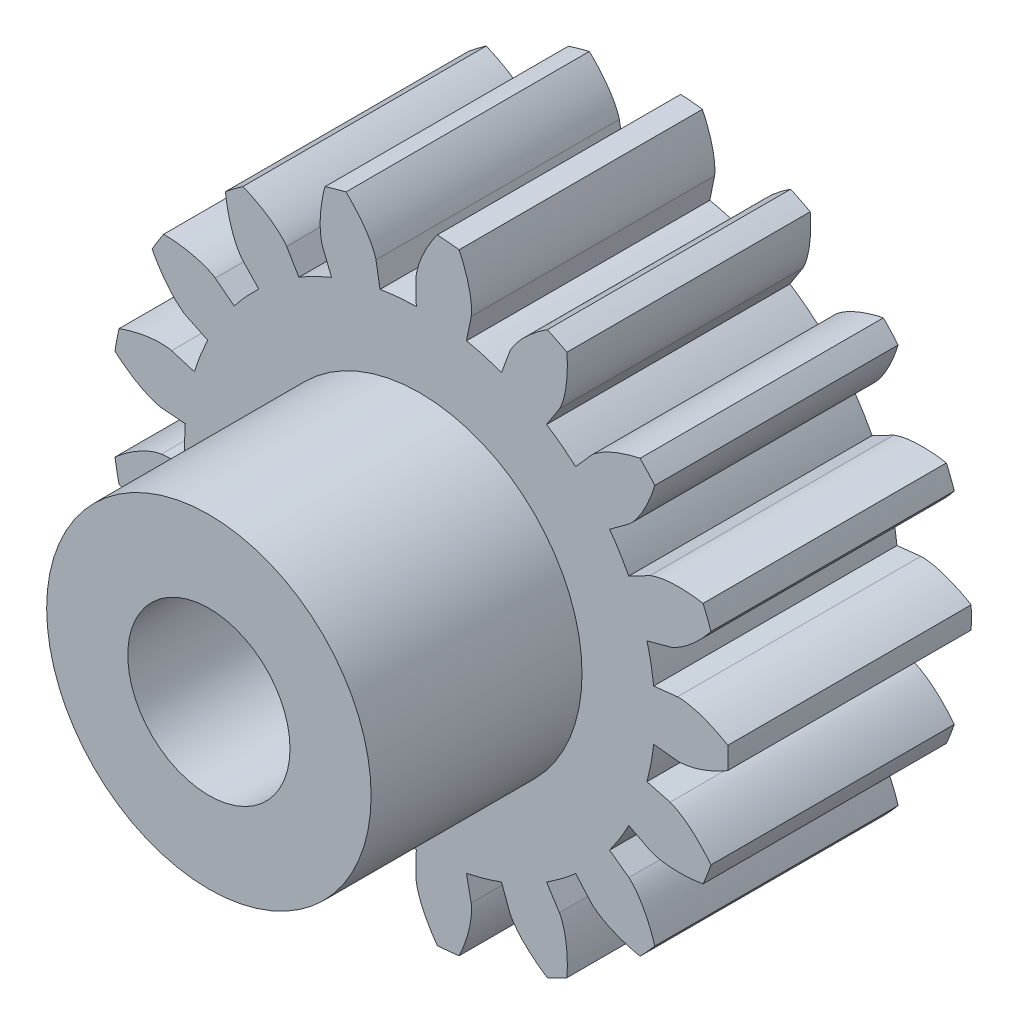
from build123d import *

# Parameters (mm, degrees)
SZKIC1_R                    = 9.5
DODANIE_WYCI_GNI_CIE1_DEPTH = 7.5
SZKIC2_R                    = 5
DODANIE_WYCI_GNI_CIE2_DEPTH = 6.5
SZKIC3_R                    = 2.5
WYTNIJ_WYCI_GNI_CIE1_DEPTH  = 20.403607912
WYTNIJ_WYCI_GNI_CIE3_DEPTH  = 10


with BuildPart() as part:
    # Szkic1 → Dodanie-wyciągnięcie1 (new body)
    with BuildSketch(Plane.XY):
        Circle(SZKIC1_R)
    extrude(amount=DODANIE_WYCI_GNI_CIE1_DEPTH)

    # Szkic2 → Dodanie-wyciągnięcie2 (add)
    with BuildSketch(Plane.XY.offset(7.5)):
        Circle(SZKIC2_R)
    extrude(amount=DODANIE_WYCI_GNI_CIE2_DEPTH)

    # Szkic3 → Wytnij-wyciągnięcie1 (cut, through all)
    with BuildSketch(Plane.XY.offset(14)):
        Circle(SZKIC3_R)
    extrude(amount=-WYTNIJ_WYCI_GNI_CIE1_DEPTH, mode=Mode.SUBTRACT)

    # Szkic5 → Wytnij-wyciągnięcie3 (cut)
    with BuildSketch(Plane(origin=(0, 0, 0), x_dir=(-1, 0, 0), z_dir=(0, 0, -1))):
        with BuildLine():
            add(Edge.make_bspline(
                [(7.963415002, 0.618366401), (7.966722573, 0.618676105), (7.975983606, 0.619707212), (7.993424766, 0.622297686), (8.021760868, 0.627431857), (8.057662939, 0.635303285), (8.103794176, 0.646996952), (8.157749457, 0.662718274), (8.216590608, 0.682022962), (8.280068362, 0.705199458), (8.342882573, 0.730232638), (8.405029368, 0.75697113), (8.466451614, 0.785192994), (8.540242586, 0.821237905), (8.627851604, 0.867035666), (8.728883622, 0.92427545), (8.841778762, 0.993539678), (8.954897675, 1.068706007), (9.064568692, 1.146407595), (9.173368323, 1.229133774), (9.267644132, 1.304516793), (9.337006218, 1.36343296), (9.378413038, 1.399396049), (9.394282015, 1.413317167)],
                knots=[0, 0, 0, 0, 0, 0.005376749, 0.015083688, 0.02853182, 0.046610139, 0.064854849, 0.092110525, 0.119476176, 0.146842496, 0.174208854, 0.201574956, 0.228941013, 0.256307345, 0.307035032, 0.361767352, 0.416499661, 0.471231937, 0.525964282, 0.580696615, 0.635428982, 0.670002826, 0.670002826, 0.670002826, 0.670002826, 0.670002826], degree=4))
            Line((7.963415002, 0.618366401), (7.228240821, 0.561279459))
            add(Edge.make_bspline(
                [(7.228240821, 0.561279459), (7.27156332, -0.003365835), (7.228240821, -0.561279459)],
                knots=[0, 0, 0, 0.49973366, 0.49973366, 0.49973366], degree=2))
            Line((7.228240821, -0.561279459), (7.963415002, -0.618366401))
            add(Edge.make_bspline(
                [(7.963415002, -0.618366401), (7.966722573, -0.618676105), (7.975983606, -0.619707212), (7.993424766, -0.622297686), (8.021760868, -0.627431857), (8.057662939, -0.635303285), (8.103794176, -0.646996952), (8.157749457, -0.662718274), (8.216590608, -0.682022962), (8.280068362, -0.705199458), (8.342882573, -0.730232638), (8.405029368, -0.75697113), (8.466451614, -0.785192994), (8.540242586, -0.821237905), (8.627851604, -0.867035666), (8.728883622, -0.92427545), (8.841778762, -0.993539678), (8.954897675, -1.068706007), (9.064568692, -1.146407595), (9.173368323, -1.229133774), (9.267644132, -1.304516793), (9.337006218, -1.36343296), (9.378413038, -1.399396049), (9.394282015, -1.413317167)],
                knots=[0, 0, 0, 0, 0, 0.005376749, 0.015083688, 0.02853182, 0.046610139, 0.064854849, 0.092110525, 0.119476176, 0.146842496, 0.174208854, 0.201574956, 0.228941013, 0.256307345, 0.307035032, 0.361767352, 0.416499661, 0.471231937, 0.525964282, 0.580696615, 0.635428982, 0.670002826, 0.670002826, 0.670002826, 0.670002826, 0.670002826], degree=4))
            ThreePointArc((9.394282015, -1.413317167), (9.5, 0), (9.394282015, 1.413317167))
        make_face()
        with BuildLine():
            add(Edge.make_bspline(
                [(7.64904305, 2.300107807), (7.652239145, 2.301013849), (7.66124728, 2.303397841), (7.678446465, 2.307282771), (7.70672377, 2.31273148), (7.743044942, 2.318360915), (7.790285279, 2.324121421), (7.846276277, 2.32895262), (7.908117674, 2.33220741), (7.975681232, 2.333526781), (8.043296767, 2.332875145), (8.110905985, 2.330392256), (8.178375437, 2.326264426), (8.260204393, 2.319309921), (8.358441429, 2.308252809), (8.473328375, 2.291375274), (8.603621083, 2.267570734), (8.736254537, 2.238343484), (8.866588767, 2.205506652), (8.997925544, 2.167669747), (9.113066604, 2.131433526), (9.199027798, 2.101552312), (9.250629874, 2.082975598), (9.270456143, 2.075727078)],
                knots=[0, 0, 0, 0, 0, 0.005376749, 0.015083688, 0.02853182, 0.046610139, 0.064854849, 0.092110525, 0.119476176, 0.146842496, 0.174208854, 0.201574956, 0.228941013, 0.256307345, 0.307035032, 0.361767352, 0.416499661, 0.471231937, 0.525964282, 0.580696615, 0.635428982, 0.670002826, 0.670002826, 0.670002826, 0.670002826, 0.670002826], degree=4))
            ThreePointArc((9.270456143, 2.075727078), (8.858486179, 3.431795829), (8.249358046, 4.711485098))
            add(Edge.make_bspline(
                [(7.202283632, 3.453326801), (7.205255971, 3.454810423), (7.213519148, 3.459117373), (7.228846759, 3.467833391), (7.253414711, 3.482857044), (7.284048907, 3.503166256), (7.322840765, 3.530734801), (7.36747337, 3.564885393), (7.415367451, 3.604142354), (7.466186378, 3.648684602), (7.515715857, 3.694718458), (7.56400696, 3.74210137), (7.611086586, 3.790605749), (7.666873694, 3.850873001), (7.732022612, 3.925226169), (7.805554768, 4.015097653), (7.885805226, 4.12046705), (7.96413226, 4.231420829), (8.038328387, 4.343493144), (8.109896879, 4.459935968), (8.170574965, 4.56428489), (8.21397021, 4.644279055), (8.239589553, 4.692771506), (8.249358046, 4.711485098)],
                knots=[0, 0, 0, 0, 0, 0.005376749, 0.015083688, 0.02853182, 0.046610139, 0.064854849, 0.092110525, 0.119476176, 0.146842496, 0.174208854, 0.201574956, 0.228941013, 0.256307345, 0.307035032, 0.361767352, 0.416499661, 0.471231937, 0.525964282, 0.580696615, 0.635428982, 0.670002826, 0.670002826, 0.670002826, 0.670002826, 0.670002826], degree=4))
            Line((7.202283632, 3.453326801), (6.537376306, 3.134519266))
            add(Edge.make_bspline(
                [(6.537376306, 3.134519266), (6.78174674, 2.623653102), (6.94289136, 2.087764249)],
                knots=[0, 0, 0, 0.49973366, 0.49973366, 0.49973366], degree=2))
            Line((6.94289136, 2.087764249), (7.64904305, 2.300107807))
        make_face()
        with BuildLine():
            ThreePointArc((8.249358046, -4.711485098), (8.858486179, -3.431795829), (9.270456143, -2.075727078))
            add(Edge.make_bspline(
                [(7.64904305, -2.300107807), (7.652239145, -2.301013849), (7.66124728, -2.303397841), (7.678446465, -2.307282771), (7.70672377, -2.31273148), (7.743044942, -2.318360915), (7.790285279, -2.324121421), (7.846276277, -2.32895262), (7.908117674, -2.33220741), (7.975681232, -2.333526781), (8.043296767, -2.332875145), (8.110905985, -2.330392256), (8.178375437, -2.326264426), (8.260204393, -2.319309921), (8.358441429, -2.308252809), (8.473328375, -2.291375274), (8.603621083, -2.267570734), (8.736254537, -2.238343484), (8.866588767, -2.205506652), (8.997925544, -2.167669747), (9.113066604, -2.131433526), (9.199027798, -2.101552312), (9.250629874, -2.082975598), (9.270456143, -2.075727078)],
                knots=[0, 0, 0, 0, 0, 0.005376749, 0.015083688, 0.02853182, 0.046610139, 0.064854849, 0.092110525, 0.119476176, 0.146842496, 0.174208854, 0.201574956, 0.228941013, 0.256307345, 0.307035032, 0.361767352, 0.416499661, 0.471231937, 0.525964282, 0.580696615, 0.635428982, 0.670002826, 0.670002826, 0.670002826, 0.670002826, 0.670002826], degree=4))
            Line((7.64904305, -2.300107807), (6.94289136, -2.087764249))
            add(Edge.make_bspline(
                [(6.94289136, -2.087764249), (6.779314981, -2.629930197), (6.537376306, -3.134519266)],
                knots=[0, 0, 0, 0.49973366, 0.49973366, 0.49973366], degree=2))
            Line((6.537376306, -3.134519266), (7.202283632, -3.453326801))
            add(Edge.make_bspline(
                [(7.202283632, -3.453326801), (7.205255971, -3.454810423), (7.213519148, -3.459117373), (7.228846759, -3.467833391), (7.253414711, -3.482857044), (7.284048907, -3.503166256), (7.322840765, -3.530734801), (7.36747337, -3.564885393), (7.415367451, -3.604142354), (7.466186378, -3.648684602), (7.515715857, -3.694718458), (7.56400696, -3.74210137), (7.611086586, -3.790605749), (7.666873694, -3.850873001), (7.732022612, -3.925226169), (7.805554768, -4.015097653), (7.885805226, -4.12046705), (7.96413226, -4.231420829), (8.038328387, -4.343493144), (8.109896879, -4.459935968), (8.170574965, -4.56428489), (8.21397021, -4.644279055), (8.239589553, -4.692771506), (8.249358046, -4.711485098)],
                knots=[0, 0, 0, 0, 0, 0.005376749, 0.015083688, 0.02853182, 0.046610139, 0.064854849, 0.092110525, 0.119476176, 0.146842496, 0.174208854, 0.201574956, 0.228941013, 0.256307345, 0.307035032, 0.361767352, 0.416499661, 0.471231937, 0.525964282, 0.580696615, 0.635428982, 0.670002826, 0.670002826, 0.670002826, 0.670002826, 0.670002826], degree=4))
        make_face()
        with BuildLine():
            add(Edge.make_bspline(
                [(6.301625449, 4.907939711), (6.304278419, 4.909939133), (6.311817057, 4.915416253), (6.326451421, 4.925251904), (6.350850922, 4.940547614), (6.382685819, 4.958917627), (6.424655188, 4.981354317), (6.475120007, 5.006085558), (6.531609627, 5.031460248), (6.594134157, 5.057097297), (6.657419164, 5.080915213), (6.721359805, 5.103023255), (6.785764339, 5.123546945), (6.864579825, 5.146622091), (6.960177423, 5.171798951), (7.073403179, 5.197563071), (7.203496702, 5.222433153), (7.337731815, 5.243092284), (7.471126897, 5.259555004), (7.60726306, 5.271717457), (7.727718935, 5.279521936), (7.818669701, 5.282711298), (7.873497886, 5.284029849), (7.894603799, 5.284432879)],
                knots=[0, 0, 0, 0, 0, 0.005376749, 0.015083688, 0.02853182, 0.046610139, 0.064854849, 0.092110525, 0.119476176, 0.146842496, 0.174208854, 0.201574956, 0.228941013, 0.256307345, 0.307035032, 0.361767352, 0.416499661, 0.471231937, 0.525964282, 0.580696615, 0.635428982, 0.670002826, 0.670002826, 0.670002826, 0.670002826, 0.670002826], degree=4))
            ThreePointArc((7.894603799, 5.284432879), (7.020584714, 6.400108615), (5.990312562, 7.373340858))
            add(Edge.make_bspline(
                [(5.468443947, 5.82189628), (5.470679625, 5.82435345), (5.476828959, 5.831354565), (5.487972941, 5.845018982), (5.505454705, 5.867903088), (5.526683708, 5.897907213), (5.552897132, 5.93762735), (5.58217918, 5.985594985), (5.61265783, 6.039502349), (5.643954552, 6.099394672), (5.673510069, 6.160212076), (5.7014235, 6.221840085), (5.727802141, 6.284076193), (5.758051027, 6.360426361), (5.791941121, 6.453293128), (5.82804249, 6.56365867), (5.864809997, 6.690902515), (5.897766653, 6.822658822), (5.926467292, 6.953965875), (5.951138923, 7.088399096), (5.970024375, 7.207621021), (5.98159201, 7.297889529), (5.987963842, 7.352362167), (5.990312562, 7.373340858)],
                knots=[0, 0, 0, 0, 0, 0.005376749, 0.015083688, 0.02853182, 0.046610139, 0.064854849, 0.092110525, 0.119476176, 0.146842496, 0.174208854, 0.201574956, 0.228941013, 0.256307345, 0.307035032, 0.361767352, 0.416499661, 0.471231937, 0.525964282, 0.580696615, 0.635428982, 0.670002826, 0.670002826, 0.670002826, 0.670002826, 0.670002826], degree=4))
            Line((5.468443947, 5.82189628), (4.963602896, 5.284424878))
            add(Edge.make_bspline(
                [(4.963602896, 5.284424878), (5.376017684, 4.896333149), (5.719865949, 4.454843827)],
                knots=[0, 0, 0, 0.49973366, 0.49973366, 0.49973366], degree=2))
            Line((5.719865949, 4.454843827), (6.301625449, 4.907939711))
        make_face()
        with BuildLine():
            ThreePointArc((5.990312562, -7.373340858), (7.020584714, -6.400108615), (7.894603799, -5.284432879))
            add(Edge.make_bspline(
                [(6.301625449, -4.907939711), (6.304278419, -4.909939133), (6.311817057, -4.915416253), (6.326451421, -4.925251904), (6.350850922, -4.940547614), (6.382685819, -4.958917627), (6.424655188, -4.981354317), (6.475120007, -5.006085558), (6.531609627, -5.031460248), (6.594134157, -5.057097297), (6.657419164, -5.080915213), (6.721359805, -5.103023255), (6.785764339, -5.123546945), (6.864579825, -5.146622091), (6.960177423, -5.171798951), (7.073403179, -5.197563071), (7.203496702, -5.222433153), (7.337731815, -5.243092284), (7.471126897, -5.259555004), (7.60726306, -5.271717457), (7.727718935, -5.279521936), (7.818669701, -5.282711298), (7.873497886, -5.284029849), (7.894603799, -5.284432879)],
                knots=[0, 0, 0, 0, 0, 0.005376749, 0.015083688, 0.02853182, 0.046610139, 0.064854849, 0.092110525, 0.119476176, 0.146842496, 0.174208854, 0.201574956, 0.228941013, 0.256307345, 0.307035032, 0.361767352, 0.416499661, 0.471231937, 0.525964282, 0.580696615, 0.635428982, 0.670002826, 0.670002826, 0.670002826, 0.670002826, 0.670002826], degree=4))
            Line((6.301625449, -4.907939711), (5.719865949, -4.454843827))
            add(Edge.make_bspline(
                [(5.719865949, -4.454843827), (5.371482587, -4.901307914), (4.963602896, -5.284424878)],
                knots=[0, 0, 0, 0.49973366, 0.49973366, 0.49973366], degree=2))
            Line((4.963602896, -5.284424878), (5.468443947, -5.82189628))
            add(Edge.make_bspline(
                [(5.468443947, -5.82189628), (5.470679625, -5.82435345), (5.476828959, -5.831354565), (5.487972941, -5.845018982), (5.505454705, -5.867903088), (5.526683708, -5.897907213), (5.552897132, -5.93762735), (5.58217918, -5.985594985), (5.61265783, -6.039502349), (5.643954552, -6.099394672), (5.673510069, -6.160212076), (5.7014235, -6.221840085), (5.727802141, -6.284076193), (5.758051027, -6.360426361), (5.791941121, -6.453293128), (5.82804249, -6.56365867), (5.864809997, -6.690902515), (5.897766653, -6.822658822), (5.926467292, -6.953965875), (5.951138923, -7.088399096), (5.970024375, -7.207621021), (5.98159201, -7.297889529), (5.987963842, -7.352362167), (5.990312562, -7.373340858)],
                knots=[0, 0, 0, 0, 0, 0.005376749, 0.015083688, 0.02853182, 0.046610139, 0.064854849, 0.092110525, 0.119476176, 0.146842496, 0.174208854, 0.201574956, 0.228941013, 0.256307345, 0.307035032, 0.361767352, 0.416499661, 0.471231937, 0.525964282, 0.580696615, 0.635428982, 0.670002826, 0.670002826, 0.670002826, 0.670002826, 0.670002826], degree=4))
        make_face()
        with BuildLine():
            add(Edge.make_bspline(
                [(4.103138413, 6.852927161), (4.104889959, 6.85574993), (4.109940966, 6.863580462), (4.120034057, 6.878038476), (4.137260466, 6.901115417), (4.160309609, 6.929745035), (4.191339813, 6.96582771), (4.229462901, 7.007118901), (4.272971507, 7.051186499), (4.322012725, 7.097678801), (4.372420212, 7.142749528), (4.424056739, 7.186462686), (4.476698166, 7.228866059), (4.541855714, 7.278854429), (4.621902888, 7.336864987), (4.718175688, 7.401791174), (4.830500175, 7.471977036), (4.948207752, 7.539732418), (5.066647941, 7.603271309), (5.189197548, 7.663790513), (5.298700003, 7.714581654), (5.382356935, 7.750410852), (5.433006381, 7.771446589), (5.452541466, 7.779446738)],
                knots=[0, 0, 0, 0, 0, 0.005376749, 0.015083688, 0.02853182, 0.046610139, 0.064854849, 0.092110525, 0.119476176, 0.146842496, 0.174208854, 0.201574956, 0.228941013, 0.256307345, 0.307035032, 0.361767352, 0.416499661, 0.471231937, 0.525964282, 0.580696615, 0.635428982, 0.670002826, 0.670002826, 0.670002826, 0.670002826, 0.670002826], degree=4))
            ThreePointArc((5.452541466, 7.779446738), (4.23451438, 8.504051268), (2.922242172, 9.039386079))
            add(Edge.make_bspline(
                [(2.996060606, 7.404186407), (2.997257682, 7.407285269), (3.00046267, 7.41603501), (3.005917968, 7.43280237), (3.013952534, 7.460456306), (3.02290925, 7.496103119), (3.033003971, 7.542610425), (3.042980759, 7.597916808), (3.051927668, 7.659194086), (3.05947539, 7.726347695), (3.065065308, 7.793734919), (3.068831202, 7.861284819), (3.070946277, 7.928847327), (3.071571662, 8.010968895), (3.069625888, 8.109807091), (3.063420779, 8.225761213), (3.05173968, 8.35769452), (3.034874979, 8.492458934), (3.014203949, 8.625266982), (2.988646679, 8.759534648), (2.963188911, 8.877527994), (2.941366664, 8.965879583), (2.927630434, 9.018975577), (2.922242172, 9.039386079)],
                knots=[0, 0, 0, 0, 0, 0.005376749, 0.015083688, 0.02853182, 0.046610139, 0.064854849, 0.092110525, 0.119476176, 0.146842496, 0.174208854, 0.201574956, 0.228941013, 0.256307345, 0.307035032, 0.361767352, 0.416499661, 0.471231937, 0.525964282, 0.580696615, 0.635428982, 0.670002826, 0.670002826, 0.670002826, 0.670002826, 0.670002826], degree=4))
            Line((2.996060606, 7.404186407), (2.719467411, 6.720639627))
            add(Edge.make_bspline(
                [(2.719467411, 6.720639627), (3.24422765, 6.507736273), (3.724340947, 6.220272061)],
                knots=[0, 0, 0, 0.49973366, 0.49973366, 0.49973366], degree=2))
            Line((3.724340947, 6.220272061), (4.103138413, 6.852927161))
        make_face()
        with BuildLine():
            ThreePointArc((2.922242172, -9.039386079), (4.23451438, -8.504051268), (5.452541466, -7.779446738))
            add(Edge.make_bspline(
                [(4.103138413, -6.852927161), (4.104889959, -6.85574993), (4.109940966, -6.863580462), (4.120034057, -6.878038476), (4.137260466, -6.901115417), (4.160309609, -6.929745035), (4.191339813, -6.96582771), (4.229462901, -7.007118901), (4.272971507, -7.051186499), (4.322012725, -7.097678801), (4.372420212, -7.142749528), (4.424056739, -7.186462686), (4.476698166, -7.228866059), (4.541855714, -7.278854429), (4.621902888, -7.336864987), (4.718175688, -7.401791174), (4.830500175, -7.471977036), (4.948207752, -7.539732418), (5.066647941, -7.603271309), (5.189197548, -7.663790513), (5.298700003, -7.714581654), (5.382356935, -7.750410852), (5.433006381, -7.771446589), (5.452541466, -7.779446738)],
                knots=[0, 0, 0, 0, 0, 0.005376749, 0.015083688, 0.02853182, 0.046610139, 0.064854849, 0.092110525, 0.119476176, 0.146842496, 0.174208854, 0.201574956, 0.228941013, 0.256307345, 0.307035032, 0.361767352, 0.416499661, 0.471231937, 0.525964282, 0.580696615, 0.635428982, 0.670002826, 0.670002826, 0.670002826, 0.670002826, 0.670002826], degree=4))
            Line((4.103138413, -6.852927161), (3.724340947, -6.220272061))
            add(Edge.make_bspline(
                [(3.724340947, -6.220272061), (3.238201706, -6.510736837), (2.719467411, -6.720639627)],
                knots=[0, 0, 0, 0.49973366, 0.49973366, 0.49973366], degree=2))
            Line((2.719467411, -6.720639627), (2.996060606, -7.404186407))
            add(Edge.make_bspline(
                [(2.996060606, -7.404186407), (2.997257682, -7.407285269), (3.00046267, -7.41603501), (3.005917968, -7.43280237), (3.013952534, -7.460456306), (3.02290925, -7.496103119), (3.033003971, -7.542610425), (3.042980759, -7.597916808), (3.051927668, -7.659194086), (3.05947539, -7.726347695), (3.065065308, -7.793734919), (3.068831202, -7.861284819), (3.070946277, -7.928847327), (3.071571662, -8.010968895), (3.069625888, -8.109807091), (3.063420779, -8.225761213), (3.05173968, -8.35769452), (3.034874979, -8.492458934), (3.014203949, -8.625266982), (2.988646679, -8.759534648), (2.963188911, -8.877527994), (2.941366664, -8.965879583), (2.927630434, -9.018975577), (2.922242172, -9.039386079)],
                knots=[0, 0, 0, 0, 0, 0.005376749, 0.015083688, 0.02853182, 0.046610139, 0.064854849, 0.092110525, 0.119476176, 0.146842496, 0.174208854, 0.201574956, 0.228941013, 0.256307345, 0.307035032, 0.361767352, 0.416499661, 0.471231937, 0.525964282, 0.580696615, 0.635428982, 0.670002826, 0.670002826, 0.670002826, 0.670002826, 0.670002826], degree=4))
        make_face()
        with BuildLine():
            add(Edge.make_bspline(
                [(1.350499797, 7.872388825), (1.351113364, 7.875653709), (1.352994573, 7.884780098), (1.357183263, 7.901907839), (1.364910058, 7.929649343), (1.376060534, 7.964671977), (1.391960771, 8.009527472), (1.412593394, 8.061802009), (1.437244908, 8.118610941), (1.466179525, 8.179679453), (1.496901683, 8.239915939), (1.529260296, 8.29933051), (1.5630291, 8.357886754), (1.605728822, 8.428037142), (1.659414758, 8.511046752), (1.725732426, 8.606366364), (1.805117834, 8.712389016), (1.890400813, 8.81808991), (1.977890105, 8.920123692), (2.070302152, 9.020826194), (2.154062274, 9.107744371), (2.219127041, 9.171374473), (2.258757258, 9.209286404), (2.274083195, 9.223803208)],
                knots=[0, 0, 0, 0, 0, 0.005376749, 0.015083688, 0.02853182, 0.046610139, 0.064854849, 0.092110525, 0.119476176, 0.146842496, 0.174208854, 0.201574956, 0.228941013, 0.256307345, 0.307035032, 0.361767352, 0.416499661, 0.471231937, 0.525964282, 0.580696615, 0.635428982, 0.670002826, 0.670002826, 0.670002826, 0.670002826, 0.670002826], degree=4))
            ThreePointArc((2.274083195, 9.223803208), (0.876549415, 9.459474675), (-0.540493215, 9.484612121))
            add(Edge.make_bspline(
                [(0.119042679, 7.986500131), (0.11903948, 7.989822168), (0.118867272, 7.999138833), (0.117897116, 8.016744612), (0.115399372, 8.045433559), (0.110874147, 8.081908761), (0.103486817, 8.128922166), (0.092810925, 8.184097864), (0.079017763, 8.244469221), (0.061797123, 8.309814647), (0.042666494, 8.374670674), (0.021776246, 8.439019478), (-0.000657898, 8.502783693), (-0.029740476, 8.579585691), (-0.067259331, 8.671046669), (-0.114932882, 8.776929123), (-0.173484991, 8.895733569), (-0.237893378, 9.01530541), (-0.30514434, 9.131677988), (-0.37747886, 9.247646508), (-0.443841634, 9.34847562), (-0.496106549, 9.422977918), (-0.528095687, 9.467526359), (-0.540493215, 9.484612121)],
                knots=[0, 0, 0, 0, 0, 0.005376749, 0.015083688, 0.02853182, 0.046610139, 0.064854849, 0.092110525, 0.119476176, 0.146842496, 0.174208854, 0.201574956, 0.228941013, 0.256307345, 0.307035032, 0.361767352, 0.416499661, 0.471231937, 0.525964282, 0.580696615, 0.635428982, 0.670002826, 0.670002826, 0.670002826, 0.670002826, 0.670002826], degree=4))
            Line((0.119042679, 7.986500131), (0.108052782, 7.249194755))
            add(Edge.make_bspline(
                [(0.108052782, 7.249194755), (0.674286695, 7.240233553), (1.225823062, 7.145618085)],
                knots=[0, 0, 0, 0.49973366, 0.49973366, 0.49973366], degree=2))
            Line((1.225823062, 7.145618085), (1.350499797, 7.872388825))
        make_face()
        with BuildLine():
            ThreePointArc((-0.540493215, -9.484612121), (0.876549415, -9.459474675), (2.274083195, -9.223803208))
            add(Edge.make_bspline(
                [(1.350499797, -7.872388825), (1.351113364, -7.875653709), (1.352994573, -7.884780098), (1.357183263, -7.901907839), (1.364910058, -7.929649343), (1.376060534, -7.964671977), (1.391960771, -8.009527472), (1.412593394, -8.061802009), (1.437244908, -8.118610941), (1.466179525, -8.179679453), (1.496901683, -8.239915939), (1.529260296, -8.29933051), (1.5630291, -8.357886754), (1.605728822, -8.428037142), (1.659414758, -8.511046752), (1.725732426, -8.606366364), (1.805117834, -8.712389016), (1.890400813, -8.81808991), (1.977890105, -8.920123692), (2.070302152, -9.020826194), (2.154062274, -9.107744371), (2.219127041, -9.171374473), (2.258757258, -9.209286404), (2.274083195, -9.223803208)],
                knots=[0, 0, 0, 0, 0, 0.005376749, 0.015083688, 0.02853182, 0.046610139, 0.064854849, 0.092110525, 0.119476176, 0.146842496, 0.174208854, 0.201574956, 0.228941013, 0.256307345, 0.307035032, 0.361767352, 0.416499661, 0.471231937, 0.525964282, 0.580696615, 0.635428982, 0.670002826, 0.670002826, 0.670002826, 0.670002826, 0.670002826], degree=4))
            Line((1.350499797, -7.872388825), (1.225823062, -7.145618085))
            add(Edge.make_bspline(
                [(1.225823062, -7.145618085), (0.667583741, -7.240854673), (0.108052782, -7.249194755)],
                knots=[0, 0, 0, 0.49973366, 0.49973366, 0.49973366], degree=2))
            Line((0.108052782, -7.249194755), (0.119042679, -7.986500131))
            add(Edge.make_bspline(
                [(0.119042679, -7.986500131), (0.11903948, -7.989822168), (0.118867272, -7.999138833), (0.117897116, -8.016744612), (0.115399372, -8.045433559), (0.110874147, -8.081908761), (0.103486817, -8.128922166), (0.092810925, -8.184097864), (0.079017763, -8.244469221), (0.061797123, -8.309814647), (0.042666494, -8.374670674), (0.021776246, -8.439019478), (-0.000657898, -8.502783693), (-0.029740476, -8.579585691), (-0.067259331, -8.671046669), (-0.114932882, -8.776929123), (-0.173484991, -8.895733569), (-0.237893378, -9.01530541), (-0.30514434, -9.131677988), (-0.37747886, -9.247646508), (-0.443841634, -9.34847562), (-0.496106549, -9.422977918), (-0.528095687, -9.467526359), (-0.540493215, -9.484612121)],
                knots=[0, 0, 0, 0, 0, 0.005376749, 0.015083688, 0.02853182, 0.046610139, 0.064854849, 0.092110525, 0.119476176, 0.146842496, 0.174208854, 0.201574956, 0.228941013, 0.256307345, 0.307035032, 0.361767352, 0.416499661, 0.471231937, 0.525964282, 0.580696615, 0.635428982, 0.670002826, 0.670002826, 0.670002826, 0.670002826, 0.670002826], degree=4))
        make_face()
        with BuildLine():
            add(Edge.make_bspline(
                [(-1.584531299, 7.828640755), (-1.585138578, 7.831906815), (-1.586681234, 7.84109649), (-1.588962651, 7.858580762), (-1.591779016, 7.887240185), (-1.594033142, 7.923925835), (-1.595410286, 7.971496166), (-1.595054679, 8.027694083), (-1.59258958, 8.089571989), (-1.587669344, 8.15696907), (-1.580781714, 8.224236044), (-1.572071224, 8.29132776), (-1.561735708, 8.358128531), (-1.547260646, 8.438966738), (-1.527186531, 8.535764491), (-1.499780563, 8.648604088), (-1.464055674, 8.776144584), (-1.422715231, 8.905515497), (-1.37799275, 9.032263943), (-1.328199022, 9.159549311), (-1.281493501, 9.270855744), (-1.243808256, 9.353693151), (-1.220549549, 9.403361059), (-1.211502613, 9.422433944)],
                knots=[0, 0, 0, 0, 0, 0.005376749, 0.015083688, 0.02853182, 0.046610139, 0.064854849, 0.092110525, 0.119476176, 0.146842496, 0.174208854, 0.201574956, 0.228941013, 0.256307345, 0.307035032, 0.361767352, 0.416499661, 0.471231937, 0.525964282, 0.580696615, 0.635428982, 0.670002826, 0.670002826, 0.670002826, 0.670002826, 0.670002826], degree=4))
            ThreePointArc((-1.211502613, 9.422433944), (-2.599798406, 9.13734361), (-3.930231999, 8.64888874))
            add(Edge.make_bspline(
                [(-2.774052623, 7.490192758), (-2.775255663, 7.49328931), (-2.77878181, 7.501914633), (-2.786046394, 7.517981071), (-2.798739114, 7.543830429), (-2.816135124, 7.576207842), (-2.840006805, 7.617377925), (-2.869893539, 7.664971154), (-2.904563928, 7.716283103), (-2.944227188, 7.770995086), (-2.985494668, 7.824560749), (-3.028219712, 7.877017795), (-3.07217322, 7.928372006), (-3.127035998, 7.989481897), (-3.195060805, 8.061213346), (-3.277764222, 8.142724121), (-3.375279553, 8.232354506), (-3.478532916, 8.320584934), (-3.583281194, 8.404805282), (-3.692623787, 8.486812463), (-3.790928907, 8.556859811), (-3.866577823, 8.60745087), (-3.912499559, 8.637435245), (-3.930231999, 8.64888874)],
                knots=[0, 0, 0, 0, 0, 0.005376749, 0.015083688, 0.02853182, 0.046610139, 0.064854849, 0.092110525, 0.119476176, 0.146842496, 0.174208854, 0.201574956, 0.228941013, 0.256307345, 0.307035032, 0.361767352, 0.416499661, 0.471231937, 0.525964282, 0.580696615, 0.635428982, 0.670002826, 0.670002826, 0.670002826, 0.670002826, 0.670002826], degree=4))
            Line((-2.774052623, 7.490192758), (-2.517954973, 6.798705962))
            add(Edge.make_bspline(
                [(-2.517954973, 6.798705962), (-1.986720414, 6.994897172), (-1.438249019, 7.105908792)],
                knots=[0, 0, 0, 0.49973366, 0.49973366, 0.49973366], degree=2))
            Line((-1.438249019, 7.105908792), (-1.584531299, 7.828640755))
        make_face()
        with BuildLine():
            ThreePointArc((-3.930231999, -8.64888874), (-2.599798406, -9.13734361), (-1.211502613, -9.422433944))
            add(Edge.make_bspline(
                [(-1.584531299, -7.828640755), (-1.585138578, -7.831906815), (-1.586681234, -7.84109649), (-1.588962651, -7.858580762), (-1.591779016, -7.887240185), (-1.594033142, -7.923925835), (-1.595410286, -7.971496166), (-1.595054679, -8.027694083), (-1.59258958, -8.089571989), (-1.587669344, -8.15696907), (-1.580781714, -8.224236044), (-1.572071224, -8.29132776), (-1.561735708, -8.358128531), (-1.547260646, -8.438966738), (-1.527186531, -8.535764491), (-1.499780563, -8.648604088), (-1.464055674, -8.776144584), (-1.422715231, -8.905515497), (-1.37799275, -9.032263943), (-1.328199022, -9.159549311), (-1.281493501, -9.270855744), (-1.243808256, -9.353693151), (-1.220549549, -9.403361059), (-1.211502613, -9.422433944)],
                knots=[0, 0, 0, 0, 0, 0.005376749, 0.015083688, 0.02853182, 0.046610139, 0.064854849, 0.092110525, 0.119476176, 0.146842496, 0.174208854, 0.201574956, 0.228941013, 0.256307345, 0.307035032, 0.361767352, 0.416499661, 0.471231937, 0.525964282, 0.580696615, 0.635428982, 0.670002826, 0.670002826, 0.670002826, 0.670002826, 0.670002826], degree=4))
            Line((-1.584531299, -7.828640755), (-1.438249019, -7.105908792))
            add(Edge.make_bspline(
                [(-1.438249019, -7.105908792), (-1.993195107, -6.993054963), (-2.517954973, -6.798705962)],
                knots=[0, 0, 0, 0.49973366, 0.49973366, 0.49973366], degree=2))
            Line((-2.517954973, -6.798705962), (-2.774052623, -7.490192758))
            add(Edge.make_bspline(
                [(-2.774052623, -7.490192758), (-2.775255663, -7.49328931), (-2.77878181, -7.501914633), (-2.786046394, -7.517981071), (-2.798739114, -7.543830429), (-2.816135124, -7.576207842), (-2.840006805, -7.617377925), (-2.869893539, -7.664971154), (-2.904563928, -7.716283103), (-2.944227188, -7.770995086), (-2.985494668, -7.824560749), (-3.028219712, -7.877017795), (-3.07217322, -7.928372006), (-3.127035998, -7.989481897), (-3.195060805, -8.061213346), (-3.277764222, -8.142724121), (-3.375279553, -8.232354506), (-3.478532916, -8.320584934), (-3.583281194, -8.404805282), (-3.692623787, -8.486812463), (-3.790928907, -8.556859811), (-3.866577823, -8.60745087), (-3.912499559, -8.637435245), (-3.930231999, -8.64888874)],
                knots=[0, 0, 0, 0, 0, 0.005376749, 0.015083688, 0.02853182, 0.046610139, 0.064854849, 0.092110525, 0.119476176, 0.146842496, 0.174208854, 0.201574956, 0.228941013, 0.256307345, 0.307035032, 0.361767352, 0.416499661, 0.471231937, 0.525964282, 0.580696615, 0.635428982, 0.670002826, 0.670002826, 0.670002826, 0.670002826, 0.670002826], degree=4))
        make_face()
        with BuildLine():
            add(Edge.make_bspline(
                [(-4.305562663, 6.727591371), (-4.307308771, 6.730417508), (-4.312066949, 6.738429352), (-4.320510354, 6.753908808), (-4.333489513, 6.779615535), (-4.348843809, 6.813009601), (-4.367312343, 6.856870132), (-4.387281779, 6.909401589), (-4.40733602, 6.967991515), (-4.427094671, 7.032614815), (-4.44497178, 7.097827499), (-4.461085814, 7.163535253), (-4.475579454, 7.229558736), (-4.491283989, 7.310167115), (-4.507532816, 7.407679938), (-4.522739876, 7.522799906), (-4.53550035, 7.654633194), (-4.5436857, 7.790201869), (-4.547770047, 7.924546898), (-4.547319557, 8.061224539), (-4.543976478, 8.181886676), (-4.538760357, 8.272743739), (-4.535014376, 8.327459698), (-4.533468279, 8.348512763)],
                knots=[0, 0, 0, 0, 0, 0.005376749, 0.015083688, 0.02853182, 0.046610139, 0.064854849, 0.092110525, 0.119476176, 0.146842496, 0.174208854, 0.201574956, 0.228941013, 0.256307345, 0.307035032, 0.361767352, 0.416499661, 0.471231937, 0.525964282, 0.580696615, 0.635428982, 0.670002826, 0.670002826, 0.670002826, 0.670002826, 0.670002826], degree=4))
            ThreePointArc((-4.533468279, 8.348512763), (-5.725029046, 7.581163659), (-6.789171173, 6.645085009))
            add(Edge.make_bspline(
                [(-5.292496745, 5.982293348), (-5.294737151, 5.984746208), (-5.301141011, 5.991515291), (-5.313718901, 6.003872529), (-5.334892375, 6.023391197), (-5.362809741, 6.047298073), (-5.39994177, 6.077064586), (-5.445002977, 6.110647617), (-5.495868167, 6.145970195), (-5.552617303, 6.182659577), (-5.610448231, 6.217700538), (-5.669237819, 6.25118121), (-5.728774525, 6.283189748), (-5.802007981, 6.320354302), (-5.891351612, 6.362668491), (-5.99791534, 6.408799106), (-6.121223908, 6.457150349), (-6.249377308, 6.502123357), (-6.377476068, 6.54281705), (-6.50905941, 6.579787369), (-6.626030225, 6.60959267), (-6.714846337, 6.629439887), (-6.768498686, 6.64081064), (-6.789171173, 6.645085009)],
                knots=[0, 0, 0, 0, 0, 0.005376749, 0.015083688, 0.02853182, 0.046610139, 0.064854849, 0.092110525, 0.119476176, 0.146842496, 0.174208854, 0.201574956, 0.228941013, 0.256307345, 0.307035032, 0.361767352, 0.416499661, 0.471231937, 0.525964282, 0.580696615, 0.635428982, 0.670002826, 0.670002826, 0.670002826, 0.670002826, 0.670002826], degree=4))
            Line((-5.292496745, 5.982293348), (-4.803898957, 5.430014255))
            add(Edge.make_bspline(
                [(-4.803898957, 5.430014255), (-4.379409923, 5.804861168), (-3.908077601, 6.106507141)],
                knots=[0, 0, 0, 0.49973366, 0.49973366, 0.49973366], degree=2))
            Line((-3.908077601, 6.106507141), (-4.305562663, 6.727591371))
        make_face()
        with BuildLine():
            ThreePointArc((-6.789171173, -6.645085009), (-5.725029046, -7.581163659), (-4.533468279, -8.348512763))
            add(Edge.make_bspline(
                [(-4.305562663, -6.727591371), (-4.307308771, -6.730417508), (-4.312066949, -6.738429352), (-4.320510354, -6.753908808), (-4.333489513, -6.779615535), (-4.348843809, -6.813009601), (-4.367312343, -6.856870132), (-4.387281779, -6.909401589), (-4.40733602, -6.967991515), (-4.427094671, -7.032614815), (-4.44497178, -7.097827499), (-4.461085814, -7.163535253), (-4.475579454, -7.229558736), (-4.491283989, -7.310167115), (-4.507532816, -7.407679938), (-4.522739876, -7.522799906), (-4.53550035, -7.654633194), (-4.5436857, -7.790201869), (-4.547770047, -7.924546898), (-4.547319557, -8.061224539), (-4.543976478, -8.181886676), (-4.538760357, -8.272743739), (-4.535014376, -8.327459698), (-4.533468279, -8.348512763)],
                knots=[0, 0, 0, 0, 0, 0.005376749, 0.015083688, 0.02853182, 0.046610139, 0.064854849, 0.092110525, 0.119476176, 0.146842496, 0.174208854, 0.201574956, 0.228941013, 0.256307345, 0.307035032, 0.361767352, 0.416499661, 0.471231937, 0.525964282, 0.580696615, 0.635428982, 0.670002826, 0.670002826, 0.670002826, 0.670002826, 0.670002826], degree=4))
            Line((-4.305562663, -6.727591371), (-3.908077601, -6.106507141))
            add(Edge.make_bspline(
                [(-3.908077601, -6.106507141), (-4.384781912, -5.80080443), (-4.803898957, -5.430014255)],
                knots=[0, 0, 0, 0.49973366, 0.49973366, 0.49973366], degree=2))
            Line((-4.803898957, -5.430014255), (-5.292496745, -5.982293348))
            add(Edge.make_bspline(
                [(-5.292496745, -5.982293348), (-5.294737151, -5.984746208), (-5.301141011, -5.991515291), (-5.313718901, -6.003872529), (-5.334892375, -6.023391197), (-5.362809741, -6.047298073), (-5.39994177, -6.077064586), (-5.445002977, -6.110647617), (-5.495868167, -6.145970195), (-5.552617303, -6.182659577), (-5.610448231, -6.217700538), (-5.669237819, -6.25118121), (-5.728774525, -6.283189748), (-5.802007981, -6.320354302), (-5.891351612, -6.362668491), (-5.99791534, -6.408799106), (-6.121223908, -6.457150349), (-6.249377308, -6.502123357), (-6.377476068, -6.54281705), (-6.50905941, -6.579787369), (-6.626030225, -6.60959267), (-6.714846337, -6.629439887), (-6.768498686, -6.64081064), (-6.789171173, -6.645085009)],
                knots=[0, 0, 0, 0, 0, 0.005376749, 0.015083688, 0.02853182, 0.046610139, 0.064854849, 0.092110525, 0.119476176, 0.146842496, 0.174208854, 0.201574956, 0.228941013, 0.256307345, 0.307035032, 0.361767352, 0.416499661, 0.471231937, 0.525964282, 0.580696615, 0.635428982, 0.670002826, 0.670002826, 0.670002826, 0.670002826, 0.670002826], degree=4))
        make_face()
        with BuildLine():
            add(Edge.make_bspline(
                [(-6.445103932, 4.717943494), (-6.447753047, 4.719948021), (-6.455084128, 4.725699992), (-6.468549193, 4.737084044), (-6.48993824, 4.75636624), (-6.516319022, 4.781958668), (-6.549384668, 4.816185791), (-6.586982164, 4.857956124), (-6.626847309, 4.905345175), (-6.668616331, 4.95846696), (-6.708843778, 5.01281802), (-6.747606045, 5.068267615), (-6.784971395, 5.124596973), (-6.828734543, 5.194088915), (-6.879111818, 5.279147161), (-6.934878107, 5.380999911), (-6.994400572, 5.499321176), (-7.051006237, 5.622778311), (-7.1033458, 5.746575884), (-7.152299389, 5.874186724), (-7.192770252, 5.987908476), (-7.220727721, 6.074514444), (-7.237000382, 6.126888761), (-7.243163934, 6.147078674)],
                knots=[0, 0, 0, 0, 0, 0.005376749, 0.015083688, 0.02853182, 0.046610139, 0.064854849, 0.092110525, 0.119476176, 0.146842496, 0.174208854, 0.201574956, 0.228941013, 0.256307345, 0.307035032, 0.361767352, 0.416499661, 0.471231937, 0.525964282, 0.580696615, 0.635428982, 0.670002826, 0.670002826, 0.670002826, 0.670002826, 0.670002826], degree=4))
            ThreePointArc((-7.243163934, 6.147078674), (-8.077062789, 5.001105547), (-8.731195161, 3.743825726))
            add(Edge.make_bspline(
                [(-7.096159856, 3.666452073), (-7.099135047, 3.667929969), (-7.107551744, 3.67192861), (-7.123744226, 3.678907732), (-7.150538858, 3.689459608), (-7.185207187, 3.701667189), (-7.230584678, 3.716010001), (-7.284734592, 3.731047259), (-7.344924955, 3.745609956), (-7.411095682, 3.759321634), (-7.477679672, 3.771105415), (-7.544593944, 3.781087963), (-7.611673087, 3.789427897), (-7.693386636, 3.797627837), (-7.791982739, 3.804810001), (-7.908014756, 3.809330259), (-8.040463055, 3.809872258), (-8.176208666, 3.805513991), (-8.31035746, 3.79718512), (-8.446410491, 3.78412553), (-8.566249445, 3.769663414), (-8.656237645, 3.756086312), (-8.71037456, 3.747307759), (-8.731195161, 3.743825726)],
                knots=[0, 0, 0, 0, 0, 0.005376749, 0.015083688, 0.02853182, 0.046610139, 0.064854849, 0.092110525, 0.119476176, 0.146842496, 0.174208854, 0.201574956, 0.228941013, 0.256307345, 0.307035032, 0.361767352, 0.416499661, 0.471231937, 0.525964282, 0.580696615, 0.635428982, 0.670002826, 0.670002826, 0.670002826, 0.670002826, 0.670002826], degree=4))
            Line((-7.096159856, 3.666452073), (-6.441049767, 3.327969035))
            add(Edge.make_bspline(
                [(-6.441049767, 3.327969035), (-6.180635855, 3.830846497), (-5.850098648, 4.282387863)],
                knots=[0, 0, 0, 0.49973366, 0.49973366, 0.49973366], degree=2))
            Line((-5.850098648, 4.282387863), (-6.445103932, 4.717943494))
        make_face()
        with BuildLine():
            ThreePointArc((-8.731195161, -3.743825726), (-8.077062789, -5.001105547), (-7.243163934, -6.147078674))
            add(Edge.make_bspline(
                [(-6.445103932, -4.717943494), (-6.447753047, -4.719948021), (-6.455084128, -4.725699992), (-6.468549193, -4.737084044), (-6.48993824, -4.75636624), (-6.516319022, -4.781958668), (-6.549384668, -4.816185791), (-6.586982164, -4.857956124), (-6.626847309, -4.905345175), (-6.668616331, -4.95846696), (-6.708843778, -5.01281802), (-6.747606045, -5.068267615), (-6.784971395, -5.124596973), (-6.828734543, -5.194088915), (-6.879111818, -5.279147161), (-6.934878107, -5.380999911), (-6.994400572, -5.499321176), (-7.051006237, -5.622778311), (-7.1033458, -5.746575884), (-7.152299389, -5.874186724), (-7.192770252, -5.987908476), (-7.220727721, -6.074514444), (-7.237000382, -6.126888761), (-7.243163934, -6.147078674)],
                knots=[0, 0, 0, 0, 0, 0.005376749, 0.015083688, 0.02853182, 0.046610139, 0.064854849, 0.092110525, 0.119476176, 0.146842496, 0.174208854, 0.201574956, 0.228941013, 0.256307345, 0.307035032, 0.361767352, 0.416499661, 0.471231937, 0.525964282, 0.580696615, 0.635428982, 0.670002826, 0.670002826, 0.670002826, 0.670002826, 0.670002826], degree=4))
            Line((-6.445103932, -4.717943494), (-5.850098648, -4.282387863))
            add(Edge.make_bspline(
                [(-5.850098648, -4.282387863), (-6.184179622, -3.825123116), (-6.441049767, -3.327969035)],
                knots=[0, 0, 0, 0.49973366, 0.49973366, 0.49973366], degree=2))
            Line((-6.441049767, -3.327969035), (-7.096159856, -3.666452073))
            add(Edge.make_bspline(
                [(-7.096159856, -3.666452073), (-7.099135047, -3.667929969), (-7.107551744, -3.67192861), (-7.123744226, -3.678907732), (-7.150538858, -3.689459608), (-7.185207187, -3.701667189), (-7.230584678, -3.716010001), (-7.284734592, -3.731047259), (-7.344924955, -3.745609956), (-7.411095682, -3.759321634), (-7.477679672, -3.771105415), (-7.544593944, -3.781087963), (-7.611673087, -3.789427897), (-7.693386636, -3.797627837), (-7.791982739, -3.804810001), (-7.908014756, -3.809330259), (-8.040463055, -3.809872258), (-8.176208666, -3.805513991), (-8.31035746, -3.79718512), (-8.446410491, -3.78412553), (-8.566249445, -3.769663414), (-8.656237645, -3.756086312), (-8.71037456, -3.747307759), (-8.731195161, -3.743825726)],
                knots=[0, 0, 0, 0, 0, 0.005376749, 0.015083688, 0.02853182, 0.046610139, 0.064854849, 0.092110525, 0.119476176, 0.146842496, 0.174208854, 0.201574956, 0.228941013, 0.256307345, 0.307035032, 0.361767352, 0.416499661, 0.471231937, 0.525964282, 0.580696615, 0.635428982, 0.670002826, 0.670002826, 0.670002826, 0.670002826, 0.670002826], degree=4))
        make_face()
        with BuildLine():
            add(Edge.make_bspline(
                [(-7.714198201, 2.071111205), (-7.717392545, 2.0720234), (-7.726306426, 2.074738661), (-7.74297462, 2.080489832), (-7.769884844, 2.090743329), (-7.803729243, 2.105077719), (-7.846926303, 2.125048872), (-7.897074107, 2.150416765), (-7.951366148, 2.180204788), (-8.009504403, 2.214650666), (-8.066649248, 2.25079969), (-8.12282469, 2.288502351), (-8.178015352, 2.327529992), (-8.243926658, 2.376520226), (-8.32162865, 2.437636308), (-8.410422623, 2.512466061), (-8.50866824, 2.601295361), (-8.606049311, 2.695967386), (-8.699575342, 2.792497954), (-8.791321556, 2.893807442), (-8.870140547, 2.985230056), (-8.927495795, 3.055888313), (-8.961589385, 3.098847546), (-8.974630164, 3.115447547)],
                knots=[0, 0, 0, 0, 0, 0.005376749, 0.015083688, 0.02853182, 0.046610139, 0.064854849, 0.092110525, 0.119476176, 0.146842496, 0.174208854, 0.201574956, 0.228941013, 0.256307345, 0.307035032, 0.361767352, 0.416499661, 0.471231937, 0.525964282, 0.580696615, 0.635428982, 0.670002826, 0.670002826, 0.670002826, 0.670002826, 0.670002826], degree=4))
            ThreePointArc((-8.974630164, 3.115447547), (-9.338244447, 1.745620419), (-9.49402286, 0.336942034))
            add(Edge.make_bspline(
                [(-7.941447257, 0.855436128), (-7.944755417, 0.855739463), (-7.954048229, 0.856427622), (-7.971668419, 0.857086061), (-8.000465447, 0.857246054), (-8.037202588, 0.85610564), (-8.084697059, 0.853087673), (-8.140622434, 0.847548294), (-8.202008929, 0.839384337), (-8.268664524, 0.828266472), (-8.335009038, 0.81520161), (-8.401010851, 0.800337836), (-8.46657302, 0.783882811), (-8.545730796, 0.762010688), (-8.640263421, 0.733090836), (-8.750092959, 0.695390252), (-8.873793113, 0.648049808), (-8.998797738, 0.594948874), (-9.120879027, 0.538722299), (-9.243027033, 0.47739657), (-9.34954921, 0.420620225), (-9.428556093, 0.375452468), (-9.475866083, 0.347710201), (-9.49402286, 0.336942034)],
                knots=[0, 0, 0, 0, 0, 0.005376749, 0.015083688, 0.02853182, 0.046610139, 0.064854849, 0.092110525, 0.119476176, 0.146842496, 0.174208854, 0.201574956, 0.228941013, 0.256307345, 0.307035032, 0.361767352, 0.416499661, 0.471231937, 0.525964282, 0.580696615, 0.635428982, 0.670002826, 0.670002826, 0.670002826, 0.670002826, 0.670002826], degree=4))
            Line((-7.941447257, 0.855436128), (-7.208301115, 0.776463156))
            add(Edge.make_bspline(
                [(-7.208301115, 0.776463156), (-7.147132666, 1.339454779), (-7.002031455, 1.879908375)],
                knots=[0, 0, 0, 0.49973366, 0.49973366, 0.49973366], degree=2))
            Line((-7.002031455, 1.879908375), (-7.714198201, 2.071111205))
        make_face()
        with BuildLine():
            ThreePointArc((-9.49402286, -0.336942034), (-9.338244447, -1.745620419), (-8.974630164, -3.115447547))
            add(Edge.make_bspline(
                [(-7.714198201, -2.071111205), (-7.717392545, -2.0720234), (-7.726306426, -2.074738661), (-7.74297462, -2.080489832), (-7.769884844, -2.090743329), (-7.803729243, -2.105077719), (-7.846926303, -2.125048872), (-7.897074107, -2.150416765), (-7.951366148, -2.180204788), (-8.009504403, -2.214650666), (-8.066649248, -2.25079969), (-8.12282469, -2.288502351), (-8.178015352, -2.327529992), (-8.243926658, -2.376520226), (-8.32162865, -2.437636308), (-8.410422623, -2.512466061), (-8.50866824, -2.601295361), (-8.606049311, -2.695967386), (-8.699575342, -2.792497954), (-8.791321556, -2.893807442), (-8.870140547, -2.985230056), (-8.927495795, -3.055888313), (-8.961589385, -3.098847546), (-8.974630164, -3.115447547)],
                knots=[0, 0, 0, 0, 0, 0.005376749, 0.015083688, 0.02853182, 0.046610139, 0.064854849, 0.092110525, 0.119476176, 0.146842496, 0.174208854, 0.201574956, 0.228941013, 0.256307345, 0.307035032, 0.361767352, 0.416499661, 0.471231937, 0.525964282, 0.580696615, 0.635428982, 0.670002826, 0.670002826, 0.670002826, 0.670002826, 0.670002826], degree=4))
            Line((-7.714198201, -2.071111205), (-7.002031455, -1.879908375))
            add(Edge.make_bspline(
                [(-7.002031455, -1.879908375), (-7.148369607, -1.332837729), (-7.208301115, -0.776463156)],
                knots=[0, 0, 0, 0.49973366, 0.49973366, 0.49973366], degree=2))
            Line((-7.208301115, -0.776463156), (-7.941447257, -0.855436128))
            add(Edge.make_bspline(
                [(-7.941447257, -0.855436128), (-7.944755417, -0.855739463), (-7.954048229, -0.856427622), (-7.971668419, -0.857086061), (-8.000465447, -0.857246054), (-8.037202588, -0.85610564), (-8.084697059, -0.853087673), (-8.140622434, -0.847548294), (-8.202008929, -0.839384337), (-8.268664524, -0.828266472), (-8.335009038, -0.81520161), (-8.401010851, -0.800337836), (-8.46657302, -0.783882811), (-8.545730796, -0.762010688), (-8.640263421, -0.733090836), (-8.750092959, -0.695390252), (-8.873793113, -0.648049808), (-8.998797738, -0.594948874), (-9.120879027, -0.538722299), (-9.243027033, -0.47739657), (-9.34954921, -0.420620225), (-9.428556093, -0.375452468), (-9.475866083, -0.347710201), (-9.49402286, -0.336942034)],
                knots=[0, 0, 0, 0, 0, 0.005376749, 0.015083688, 0.02853182, 0.046610139, 0.064854849, 0.092110525, 0.119476176, 0.146842496, 0.174208854, 0.201574956, 0.228941013, 0.256307345, 0.307035032, 0.361767352, 0.416499661, 0.471231937, 0.525964282, 0.580696615, 0.635428982, 0.670002826, 0.670002826, 0.670002826, 0.670002826, 0.670002826], degree=4))
        make_face()
    extrude(amount=-WYTNIJ_WYCI_GNI_CIE3_DEPTH, mode=Mode.SUBTRACT)


solid = part.part
